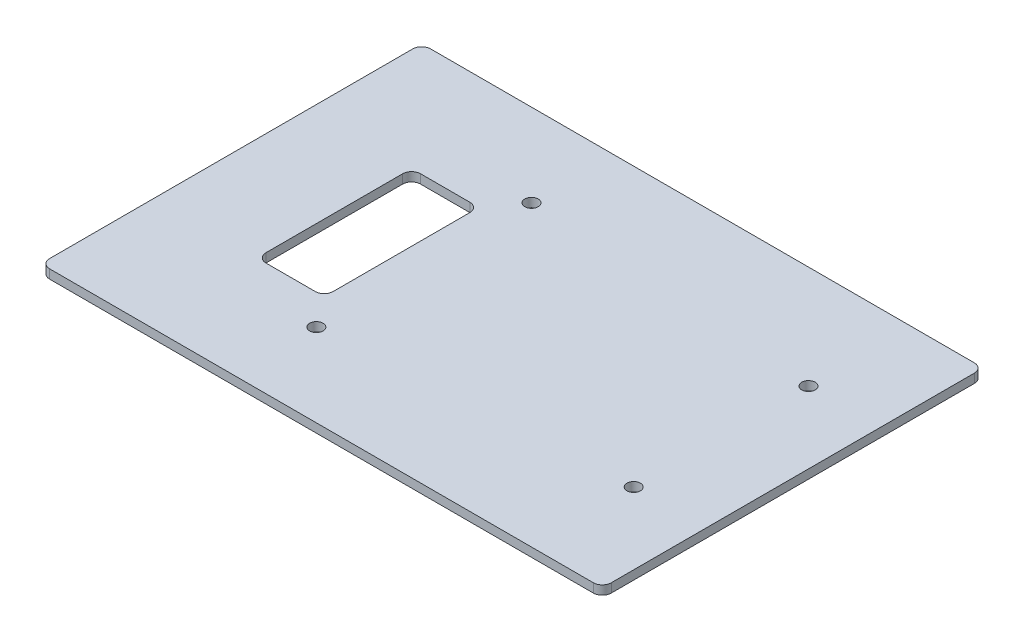
from build123d import *

# Parameters (mm, degrees)
SKETCH_1_W      = 125.3
SKETCH_1_H      = 85
SKETCH_1_R      = 1.5
SKETCH_1_W_2    = 15
SKETCH_1_H_2    = 34.5
EXTRUDE_1_DEPTH = 2
FILLET_1_R      = 2


with BuildPart() as part:
    # 草图1 → 凸台-拉伸1 (new body)
    with BuildSketch(Plane(origin=(0, 0, 0), x_dir=(1, 0, 0), z_dir=(0, 1, 0))):
        Rectangle(SKETCH_1_W, SKETCH_1_H)
        with Locations((-19.65, 24)):
            Circle(SKETCH_1_R, mode=Mode.SUBTRACT)
        with Locations((-19.65, -24)):
            Circle(SKETCH_1_R, mode=Mode.SUBTRACT)
        with Locations((46.65, 19.5)):
            Circle(SKETCH_1_R, mode=Mode.SUBTRACT)
        with Locations((46.65, -19.5)):
            Circle(SKETCH_1_R, mode=Mode.SUBTRACT)
        with Locations((-32.15, 0)):
            Rectangle(SKETCH_1_W_2, SKETCH_1_H_2, mode=Mode.SUBTRACT)
    extrude(amount=EXTRUDE_1_DEPTH)

    # 圆角1
    fillet_1_edges = [part.edges().sort_by_distance(p)[0] for p in [
        (-39.65, 1, 17.25),
        (-24.65, 1, 17.25),
        (-39.65, 1, -17.25),
        (-24.65, 1, -17.25),
        (-62.65, 1, -42.5),
        (-62.65, 1, 42.5),
        (62.65, 1, -42.5),
        (62.65, 1, 42.5),
    ]]
    fillet(fillet_1_edges, radius=FILLET_1_R)


solid = part.part
